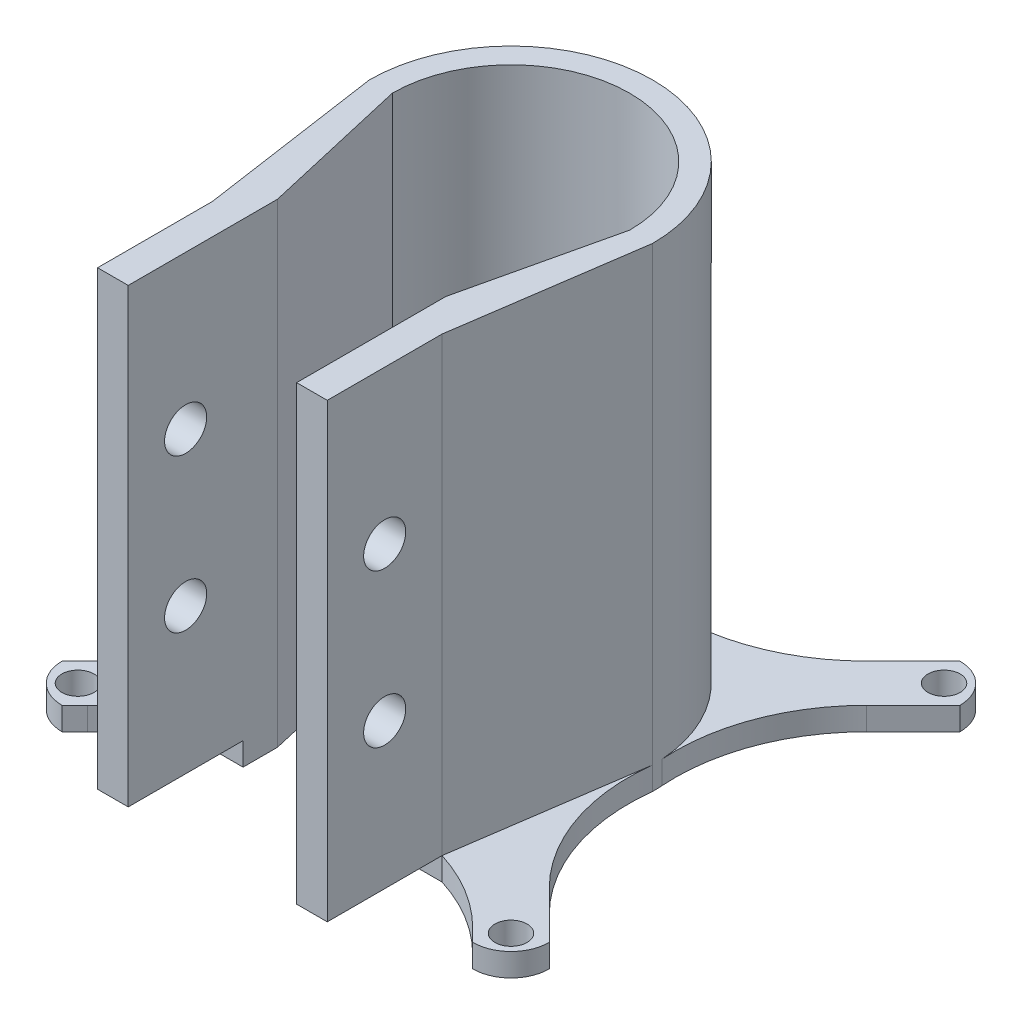
from build123d import *

# Parameters (mm, degrees)
SKETCH_1_R          = 2.1
EXTRUDE_1_DEPTH     = 3
EXTRUDE_2_DEPTH     = 59
CUT_EXTRUDE_START   = -59
CUT_EXTRUDE_1_DEPTH = 59
CUT_EXTRUDE_2_DEPTH = 59
FILLET_3_DEPTH      = 3
SKETCH_7_W          = 4
SKETCH_7_H          = 59
EXTRUDE_3_DEPTH     = 15
SKETCH_8_R          = 2.75
CUT_EXTRUDE_3_DEPTH = 136
SKETCH_9_R          = 2.75
CUT_EXTRUDE_4_DEPTH = 136


with BuildPart() as part:
    # 草图1 → 凸台-拉伸1 (new body)
    with BuildSketch(Plane(origin=(0, 0, 0), x_dir=(1, 0, 0), z_dir=(0, 1, 0))):
        with BuildLine():
            ThreePointArc((-26.819805153, 31.819805153), (-30.355339059, 30.355339059), (-31.819805153, 26.819805153))
            Line((-31.819805153, 26.819805153), (-24, 19))
            Line((-24, 19), (-24, -19))
            Line((-24, -19), (-31.819805153, -26.819805153))
            ThreePointArc((-31.819805153, -26.819805153), (-30.355339059, -30.355339059), (-26.819805153, -31.819805153))
            Line((-26.819805153, -31.819805153), (-19, -24))
            Line((-19, -24), (19, -24))
            Line((19, -24), (26.819805153, -31.819805153))
            ThreePointArc((26.819805153, -31.819805153), (30.355339059, -30.355339059), (31.819805153, -26.819805153))
            Line((31.819805153, -26.819805153), (24, -19))
            Line((24, -19), (24, 19))
            Line((24, 19), (31.819805153, 26.819805153))
            ThreePointArc((31.819805153, 26.819805153), (30.355339059, 30.355339059), (26.819805153, 31.819805153))
            Line((26.819805153, 31.819805153), (19, 24))
            Line((19, 24), (-19, 24))
            Line((-19, 24), (-26.819805153, 31.819805153))
        make_face()
        with Locations(Location((-28.284271247, 28.284271247, 0), (0, 0, 270))):
            Circle(SKETCH_1_R, mode=Mode.SUBTRACT)
        with Locations(Location((-28.284271247, -28.284271247, 0), (0, 0, 270))):
            Circle(SKETCH_1_R, mode=Mode.SUBTRACT)
        with Locations(Location((28.284271247, 28.284271247, 0), (0, 0, 270))):
            Circle(SKETCH_1_R, mode=Mode.SUBTRACT)
        with Locations(Location((28.284271247, -28.284271247, 0), (0, 0, 270))):
            Circle(SKETCH_1_R, mode=Mode.SUBTRACT)
    extrude(amount=EXTRUDE_1_DEPTH)

    # 草图2 → 凸台-拉伸2 (add)
    with BuildSketch(Plane(origin=(0, 3, 0), x_dir=(1, 0, 0), z_dir=(0, 1, 0))):
        with BuildLine():
            Line((-11, -24), (-11, -19.5))
            Line((-11, -19.5), (-15.5, 0))
            ThreePointArc((-15.5, 0), (0, 15.5), (15.5, 0))
            Line((15.5, 0), (11, -19.5))
            Line((11, -19.5), (11, -24))
            Line((11, -24), (15, -24))
            Line((15, -24), (18.5, 0))
            ThreePointArc((18.5, 0), (0, 18.5), (-18.5, 0))
            Line((-18.5, 0), (-15, -24))
            Line((-15, -24), (-11, -24))
        make_face()
    extrude(amount=EXTRUDE_2_DEPTH)

    # 草图5 → 切除-拉伸1 (cut)
    with BuildSketch(Plane(origin=(0, 3, 0), x_dir=(1, 0, 0), z_dir=(0, 1, 0)).offset(CUT_EXTRUDE_START)):
        with BuildLine():
            Line((-15.5, 0), (-11, -19.5))
            Line((-11, -19.5), (-11, -24))
            Line((-11, -24), (11, -24))
            Line((11, -24), (11, -19.5))
            Line((11, -19.5), (15.5, 0))
            ThreePointArc((15.5, 0), (0, 15.5), (-15.5, 0))
        make_face()
    extrude(amount=CUT_EXTRUDE_1_DEPTH, mode=Mode.SUBTRACT)

    # 草图6 → 切除-拉伸2 (cut)
    with BuildSketch(Plane(origin=(0, 3, 0), x_dir=(1, 0, 0), z_dir=(0, 1, 0)).offset(CUT_EXTRUDE_START)):
        with BuildLine():
            Line((-15.340366038, 10.340366038), (-24, 19))
            Line((-24, 19), (-24, -19))
            Line((-24, -19), (-16.781818182, -11.781818182))
            Line((-16.781818182, -11.781818182), (-18.5, 0))
            ThreePointArc((-18.5, 0), (-17.692466924, 5.406164458), (-15.340366038, 10.340366038))
        make_face()
        with BuildLine():
            Line((-19, 24), (-10.629360281, 15.141555403))
            ThreePointArc((-10.629360281, 15.141555403), (-0.040504877, 18.499955658), (10.562955089, 15.187955089))
            Line((10.562955089, 15.187955089), (19, 24))
            Line((19, 24), (-19, 24))
        make_face()
        Polygon((-15, -24), (-15.509090909, -20.509090909), (-19, -24), align=None)
        with BuildLine():
            Line((24, 19), (15.141555403, 10.629360281))
            ThreePointArc((15.141555403, 10.629360281), (17.640419141, 5.573653427), (18.5, 0))
            Line((18.5, 0), (16.702005947, -12.329102079))
            Line((16.702005947, -12.329102079), (24, -19))
            Line((24, -19), (24, 19))
        make_face()
        Polygon((19, -24), (15.486287413, -20.665457737), (15, -24), align=None)
    extrude(amount=CUT_EXTRUDE_2_DEPTH, mode=Mode.SUBTRACT)

    # 圆角3: read off the stored shape, not the designer's step
    # 圆角3 outline → 圆角3 (add)
    with BuildSketch(Plane(origin=(0, 0, 0), x_dir=(1, 0, 0), z_dir=(0, 1, 0))):
        with BuildLine():
            Line((-16.781818182, -11.781818182), (-18.5, 0))
            ThreePointArc((-18.5, 0), (-19.698206739, -11.144620168), (-25.645540243, -20.645540243))
            Line((-25.645540243, -20.645540243), (-16.781818182, -11.781818182))
        make_face()
        with BuildLine():
            Line((19, -24), (15.486287413, -20.665457737))
            Line((15.486287413, -20.665457737), (15, -24))
            ThreePointArc((15, -24), (20.455899997, -26.47045686), (25.167660505, -30.167660505))
            Line((25.167660505, -30.167660505), (19, -24))
        make_face()
        with BuildLine():
            ThreePointArc((25.645540243, -20.645540243), (19.698206739, -11.144620168), (18.5, 0))
            Line((18.5, 0), (16.702005947, -12.329102079))
            Line((16.702005947, -12.329102079), (24, -19))
            Line((24, -19), (25.645540243, -20.645540243))
        make_face()
        with BuildLine():
            Line((24, 19), (15.141555403, 10.629360281))
            ThreePointArc((15.141555403, 10.629360281), (17.434869544, 6.186705422), (18.454815599, 1.292200137))
            ThreePointArc((18.454815599, 1.292200137), (19.976546369, 11.792519114), (25.716086069, 20.716086069))
            Line((25.716086069, 20.716086069), (24, 19))
        make_face()
        with BuildLine():
            ThreePointArc((20.716086069, 25.716086069), (11.792519114, 19.976546369), (1.292200137, 18.454815599))
            ThreePointArc((1.292200137, 18.454815599), (6.148517769, 17.448373255), (10.562955089, 15.187955089))
            Line((10.562955089, 15.187955089), (19, 24))
            Line((19, 24), (20.716086069, 25.716086069))
        make_face()
        with BuildLine():
            Line((-19, 24), (-10.629360281, 15.141555403))
            ThreePointArc((-10.629360281, 15.141555403), (-6.186705422, 17.434869544), (-1.292200137, 18.454815599))
            ThreePointArc((-1.292200137, 18.454815599), (-11.792519114, 19.976546369), (-20.716086069, 25.716086069))
            Line((-20.716086069, 25.716086069), (-19, 24))
        make_face()
        with BuildLine():
            ThreePointArc((-25.716086069, 20.716086069), (-19.976546369, 11.792519114), (-18.454815599, 1.292200137))
            ThreePointArc((-18.454815599, 1.292200137), (-17.492738551, 6.021137598), (-15.340366038, 10.340366038))
            Line((-15.340366038, 10.340366038), (-25.716086069, 20.716086069))
        make_face()
        with BuildLine():
            Line((-15, -24), (-15.509090909, -20.509090909))
            Line((-15.509090909, -20.509090909), (-25.167660505, -30.167660505))
            ThreePointArc((-25.167660505, -30.167660505), (-20.455899997, -26.47045686), (-15, -24))
        make_face()
    extrude(amount=FILLET_3_DEPTH)

    # 草图7 → 凸台-拉伸3 (add)
    with BuildSketch(Plane.XY.offset(24)):
        with Locations((-13, 32.5)):
            Rectangle(SKETCH_7_W, SKETCH_7_H)
        with Locations((13, 32.5)):
            Rectangle(SKETCH_7_W, SKETCH_7_H)
    extrude(amount=EXTRUDE_3_DEPTH)

    # 草图8 → 切除-拉伸3 (cut)
    with BuildSketch(Plane.XY):
        with Locations((0, 37)):
            Circle(SKETCH_8_R)
    extrude(amount=-CUT_EXTRUDE_3_DEPTH, mode=Mode.SUBTRACT)

    # 草图9 → 切除-拉伸4 (cut)
    with BuildSketch(Plane.ZY.offset(15)):
        with Locations((31.5, 42)):
            Circle(SKETCH_9_R)
        with Locations((31.5, 22)):
            Circle(SKETCH_9_R)
    extrude(amount=-CUT_EXTRUDE_4_DEPTH, mode=Mode.SUBTRACT)


solid = part.part
